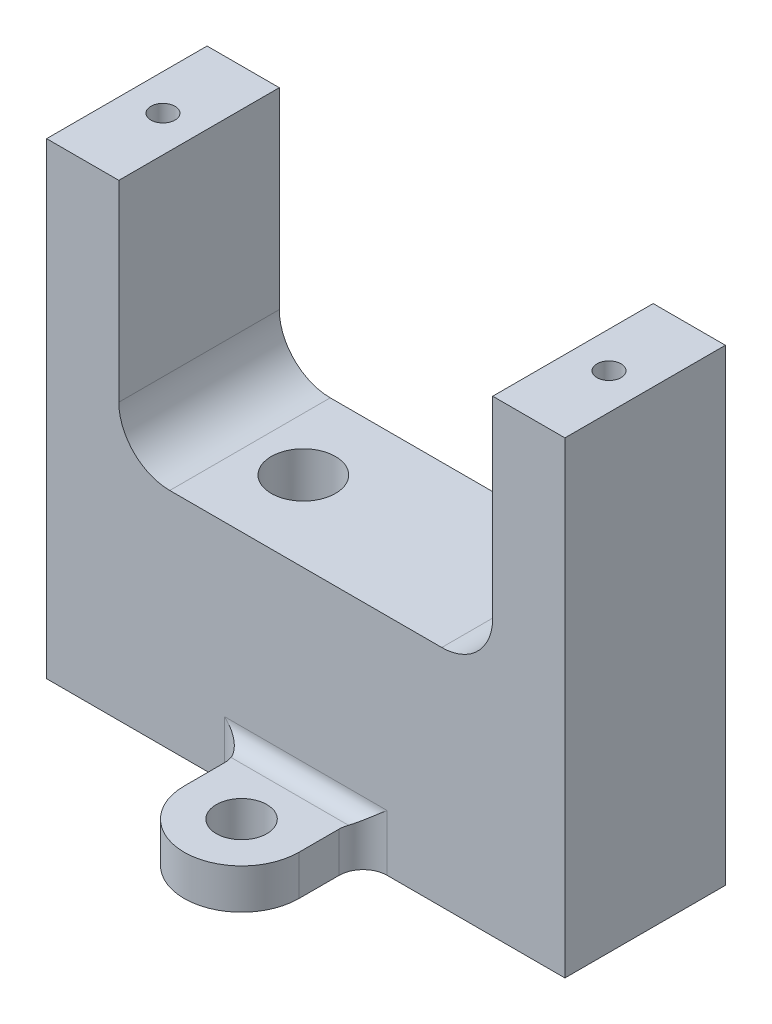
from build123d import *

# Parameters (mm, degrees)
SKETCH1_W                           = 4.5
SKETCH1_H                           = 10
BOSS_EXTRUDE1_DEPTH                 = 15.15
BOSS_EXTRUDE1_2_DEPTH               = 15.15
F_1_5_1_5_DIAMETER_HOLE1_AT_2_COUNT = 2
F_1_5_1_5_DIAMETER_HOLE1_AT_2_PITCH = 27.8
SKETCH5_W                           = 32.3
SKETCH5_H                           = 10
SKETCH5_R                           = 2
BOSS_EXTRUDE2_DEPTH                 = 14
FILLET1_R                           = 3.175
SKETCH6_R                           = 2
CUT_EXTRUDE1_DEPTH                  = 15.4
SKETCH7_R                           = 1.575
BOSS_EXTRUDE3_DEPTH                 = 2.5
FILLET3_R                           = 1.5
FILLET4_R                           = 1


with BuildPart() as part:
    # Sketch1 → Boss-Extrude1 (new body)
    with BuildSketch(Plane(origin=(0, 0, 0), x_dir=(1, 0, 0), z_dir=(0, 1, 0))):
        with Locations((-13.9, 0)):
            Rectangle(SKETCH1_W, SKETCH1_H)
    extrude(amount=-BOSS_EXTRUDE1_DEPTH)

    # Sketch4 → Ø1.5 (1.5) Diameter Hole1 (revolve, cut)
    with BuildSketch(Plane(origin=(-13.9, 0, 0), x_dir=(0, 0, 1), z_dir=(1, 0, 0))):
        Polygon((0, 0), (0, 8), (0.75, 7.549354536), (0.75, 0), align=None)
    f_1_5_1_5_diameter_hole1 = revolve(axis=Axis((-13.9, 6.35, 0), (0, -1, 0)), mode=Mode.SUBTRACT)



with BuildPart() as body_2:
    # Sketch1 → Boss-Extrude1 2 (new body)
    with BuildSketch(Plane(origin=(0, 0, 0), x_dir=(1, 0, 0), z_dir=(0, 1, 0))):
        with Locations((13.9, 0)):
            Rectangle(SKETCH1_W, SKETCH1_H)
    extrude(amount=-BOSS_EXTRUDE1_2_DEPTH)

    # Ø1.5 (1.5) Diameter Hole1 at 2: Ø1.5 (1.5) Diameter Hole1 ×2
    with Locations(*[(i * F_1_5_1_5_DIAMETER_HOLE1_AT_2_PITCH, 0, 0) for i in range(1, F_1_5_1_5_DIAMETER_HOLE1_AT_2_COUNT)]):
        add(f_1_5_1_5_diameter_hole1, mode=Mode.SUBTRACT)


with BuildPart() as part_1:
    add(part.part)

    add(body_2.part)  # Boss-Extrude2 merges body 2
    # Sketch5 → Boss-Extrude2 (add)
    with BuildSketch(Plane.XZ.offset(15.15)):
        Rectangle(SKETCH5_W, SKETCH5_H)
        with Locations((-5.15, 0)):
            Circle(SKETCH5_R, mode=Mode.SUBTRACT)
    extrude(amount=BOSS_EXTRUDE2_DEPTH)

    # Fillet1
    fillet1_edges = [part_1.edges().sort_by_distance(p)[0] for p in [
        (11.65, -15.15, 0),
        (-11.65, -15.15, 0),
    ]]
    fillet(fillet1_edges, radius=FILLET1_R)

    # Sketch6 → Cut-Extrude1 (cut)
    with BuildSketch(Plane.ZY.offset(16.15)):
        with Locations((-1.2, -20.65)):
            Circle(SKETCH6_R)
    extrude(amount=-CUT_EXTRUDE1_DEPTH, mode=Mode.SUBTRACT)

    # Sketch7 → Boss-Extrude3 (add)
    # profile 1 of 2: a face of its own
    with BuildSketch(Plane.XZ.offset(29.15)):
        with BuildLine():
            Line((3.575, -5), (-3.575, -5))
            Line((-3.575, -5), (-3.575, -9))
            ThreePointArc((-3.575, -9), (0, -12.575), (3.575, -9))
            Line((3.575, -9), (3.575, -5))
        make_face()
        with Locations((0, -9)):
            Circle(SKETCH7_R, mode=Mode.SUBTRACT)
    # profile 2 of 2: a face of its own
    with BuildSketch(Plane.XZ.offset(29.15)):
        with BuildLine():
            Line((-3.575, 5), (3.575, 5))
            Line((3.575, 5), (3.575, 9))
            ThreePointArc((3.575, 9), (0, 12.575), (-3.575, 9))
            Line((-3.575, 9), (-3.575, 5))
        make_face()
        with Locations((0, 9)):
            Circle(SKETCH7_R, mode=Mode.SUBTRACT)
    extrude(amount=-BOSS_EXTRUDE3_DEPTH)

    # Fillet3
    fillet3_edges = [part_1.edges().sort_by_distance(p)[0] for p in [
        (3.575, -27.9, -5),
        (-3.575, -27.9, -5),
        (-3.575, -27.9, 5),
        (3.575, -27.9, 5),
    ]]
    fillet(fillet3_edges, radius=FILLET3_R)

    # Fillet4
    fillet4_edges = [part_1.edges().sort_by_distance(p)[0] for p in [
        (0, -26.65, 5),
        (0, -26.65, -5),
    ]]
    fillet(fillet4_edges, radius=FILLET4_R)


solid = part_1.part
